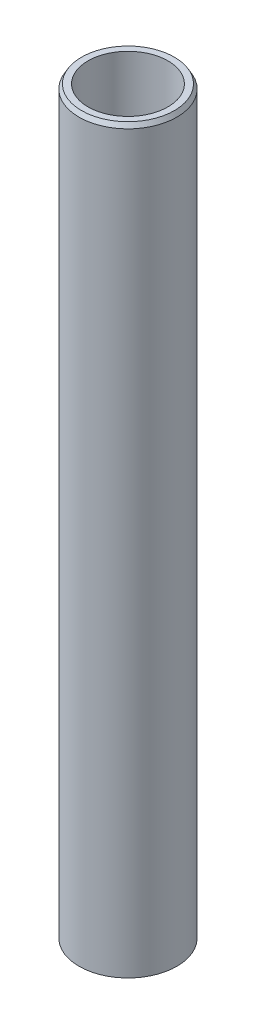
from build123d import *
from OCP.BRepFilletAPI import BRepFilletAPI_MakeChamfer

# Parameters (mm, degrees)
SKETCH1_R           = 27.5
BOSS_EXTRUDE1_DEPTH = 417.331183637
SKETCH2_R           = 22.455756568
CUT_EXTRUDE1_DEPTH  = 420.139376385
CHAMFER1_SIZE       = 2.473356309
CHAMFER1_SIZE2      = 1.427992931


with BuildPart() as part:
    # Sketch1 → Boss-Extrude1 (new body)
    with BuildSketch(Plane(origin=(0, 0, 0), x_dir=(1, 0, 0), z_dir=(0, 1, 0))):
        Circle(SKETCH1_R)
    extrude(amount=BOSS_EXTRUDE1_DEPTH)

    # Sketch2 → Cut-Extrude1 (cut, through all)
    with BuildSketch(Plane(origin=(0, 0, 0), x_dir=(1, 0, 0), z_dir=(0, 1, 0))):
        Circle(SKETCH2_R)
    extrude(amount=CUT_EXTRUDE1_DEPTH, mode=Mode.SUBTRACT)

    # Chamfer1: one chamfer whose edges measure the first distance from different faces: ONE call of the kernel's chamfer builder (chamfer() names one face for all edges)
    chamfer1_edges_1 = [part.edges().sort_by_distance(p)[0] for p in [
        (-27.5, 417.331183637, 0),
    ]]
    chamfer1_side_1 = [part.faces().sort_by_distance(p)[0] for p in [
        (-27.5, 208.665591819, 0),
    ]]
    chamfer1_edges_2 = [part.edges().sort_by_distance(p)[0] for p in [
        (-27.5, 0, 0),
    ]]
    chamfer1_side_2 = [part.faces().sort_by_distance(p)[0] for p in [
        (-26.722182541, 0, 0),
    ]]
    chamfer1 = BRepFilletAPI_MakeChamfer(part.part.solid().wrapped)
    for e in chamfer1_edges_1:
        chamfer1.Add(CHAMFER1_SIZE, CHAMFER1_SIZE2, e.wrapped, chamfer1_side_1[0].wrapped)  # the first distance lies on this face
    for e in chamfer1_edges_2:
        chamfer1.Add(CHAMFER1_SIZE, CHAMFER1_SIZE2, e.wrapped, chamfer1_side_2[0].wrapped)  # the first distance lies on this face
    add(Compound.cast(chamfer1.Shape()), mode=Mode.REPLACE)


solid = part.part
